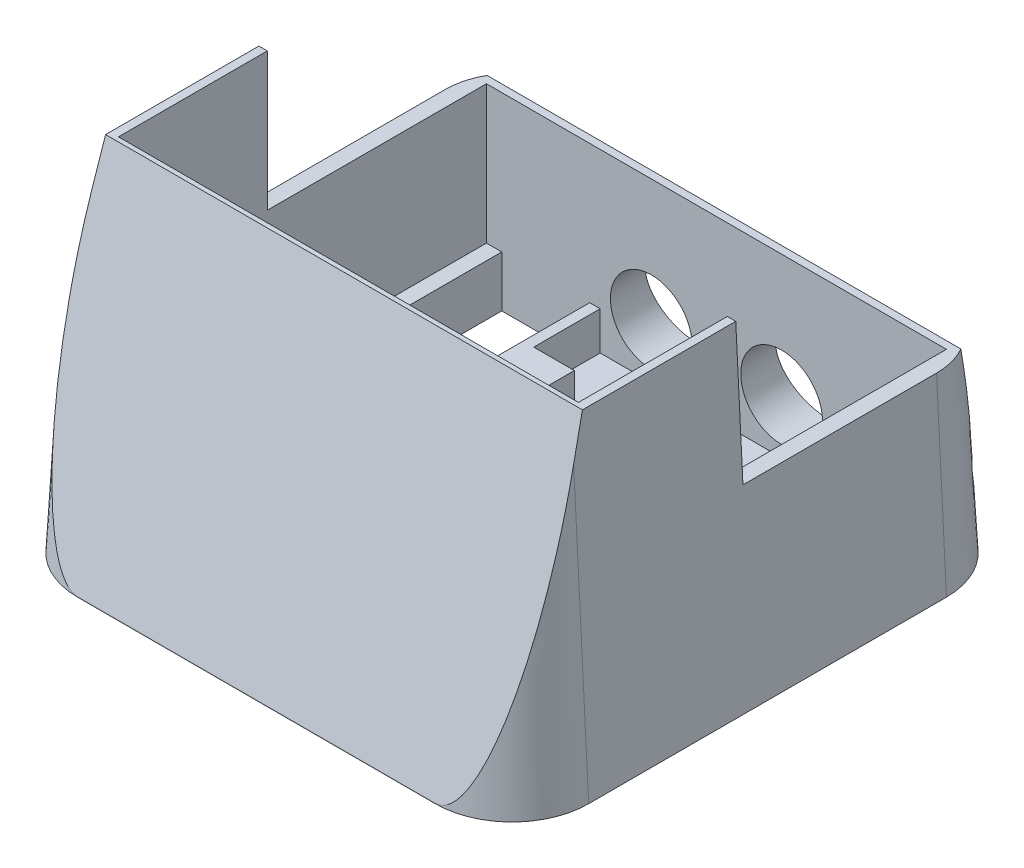
from build123d import *

# Parameters (mm, degrees)
BOSS_EXTRUDE1_DEPTH     = 10
SKETCH2_W               = 17.2
SKETCH2_H               = 43
CUT_EXTRUDE1_DEPTH      = 72.414284285
SKETCH3_W               = 90
SKETCH3_H               = 34
SKETCH3_W_2             = 80
SKETCH3_H_2             = 24
BOSS_EXTRUDE3_DEPTH     = 15
SKETCH4_W               = 49.6
SKETCH4_H               = 5
BOSS_EXTRUDE4_DEPTH     = 10
SKETCH5_W               = 15
SKETCH5_H               = 22
BOSS_EXTRUDE5_DEPTH     = 5
SKETCH6_W               = 90
SKETCH6_H               = 77
BOSS_EXTRUDE6_DEPTH     = 15
BOSS_EXTRUDE8_DEPTH     = 39
CHAMFER1_SIZE           = 64
CHAMFER1_SIZE_2         = 3.354097874
CHAMFER2_SIZE           = 64
CHAMFER2_SIZE_2         = 11.405813635
CHAMFER3_SIZE           = 64
CHAMFER3_SIZE_2         = 13.775745352
CUT_EXTRUDE3_DEPTH      = 95.500525601
CUT_EXTRUDE3_DEPTH_BACK = 95.500525601
SKETCH10_W              = 50
SKETCH10_H              = 27
SKETCH11_W              = 45.5
SKETCH11_H              = 10.5
CUT_EXTRUDE4_DEPTH      = 7.5
SKETCH14_W              = 2.05
SKETCH14_H              = 10.5
BOSS_EXTRUDE9_DEPTH     = 15
SKETCH15_R              = 8
CUT_EXTRUDE5_DEPTH      = 122.227059686
CUT_EXTRUDE6_DEPTH      = 2.5
CUT_EXTRUDE7_REACH      = 97.373
SKETCH18_W              = 29.6
SKETCH18_H              = 45
CUT_EXTRUDE8_DEPTH      = 15
SKETCH21_W              = 29.6
SKETCH21_H              = 35
BOSS_EXTRUDE10_DEPTH    = 2.5
SKETCH22_W              = 90
SKETCH22_H              = 72
CUT_EXTRUDE9_DEPTH      = 54


with BuildPart() as part:
    # Sketch1 → Boss-Extrude1 (new body)
    with BuildSketch(Plane(origin=(0, 0, 0), x_dir=(1, 0, 0), z_dir=(0, 1, 0))):
        with BuildLine():
            Line((-35, 50), (35, 50))
            ThreePointArc((35, 50), (45.606601718, 45.606601718), (50, 35))
            Line((50, 35), (50, -35))
            ThreePointArc((50, -35), (45.606601718, -45.606601718), (35, -50))
            Line((35, -50), (-35, -50))
            ThreePointArc((-35, -50), (-45.606601718, -45.606601718), (-50, -35))
            Line((-50, -35), (-50, 35))
            ThreePointArc((-50, 35), (-45.606601718, 45.606601718), (-35, 50))
        make_face()
    extrude(amount=BOSS_EXTRUDE1_DEPTH)

    # Sketch2 → Cut-Extrude1 (cut, through all)
    with BuildSketch(Plane(origin=(0, 10, 0), x_dir=(1, 0, 0), z_dir=(0, 1, 0))):
        with Locations((-33.4, 18.5)):
            Rectangle(SKETCH2_W, SKETCH2_H)
        with Locations((33.4, 18.5)):
            Rectangle(SKETCH2_W, SKETCH2_H)
    extrude(amount=-CUT_EXTRUDE1_DEPTH, mode=Mode.SUBTRACT)

    # Sketch3 → Boss-Extrude3 (add)
    with BuildSketch(Plane(origin=(0, 10, 0), x_dir=(1, 0, 0), z_dir=(0, 1, 0))):
        with Locations((0, -20)):
            Rectangle(SKETCH3_W, SKETCH3_H)
        with Locations((0, -20)):
            Rectangle(SKETCH3_W_2, SKETCH3_H_2, mode=Mode.SUBTRACT)
    extrude(amount=BOSS_EXTRUDE3_DEPTH)

    # Sketch4 → Boss-Extrude4 (add)
    with BuildSketch(Plane(origin=(0, 10, 0), x_dir=(1, 0, 0), z_dir=(0, 1, 0))):
        with Locations((0, 10)):
            Rectangle(SKETCH4_W, SKETCH4_H)
        with Locations((0, 27)):
            Rectangle(SKETCH4_W, SKETCH4_H)
    extrude(amount=BOSS_EXTRUDE4_DEPTH)

    # Sketch5 → Boss-Extrude5 (add)
    with BuildSketch(Plane(origin=(0, 20, 0), x_dir=(1, 0, 0), z_dir=(0, 1, 0))):
        with Locations((-17.3, 18.5)):
            Rectangle(SKETCH5_W, SKETCH5_H)
        with Locations((17.3, 18.5)):
            Rectangle(SKETCH5_W, SKETCH5_H)
    extrude(amount=BOSS_EXTRUDE5_DEPTH)

    # Sketch6 → Boss-Extrude6 (add)
    with BuildSketch(Plane(origin=(0, 10, 0), x_dir=(1, 0, 0), z_dir=(0, 1, 0))):
        with BuildLine():
            Line((-50, 35), (-50, -35))
            ThreePointArc((-50, -35), (-45.606601718, -45.606601718), (-35, -50))
            Line((-35, -50), (35, -50))
            ThreePointArc((35, -50), (45.606601718, -45.606601718), (50, -35))
            Line((50, -35), (50, 35))
            ThreePointArc((50, 35), (45.606601718, 45.606601718), (35, 50))
            Line((35, 50), (-35, 50))
            ThreePointArc((-35, 50), (-45.606601718, 45.606601718), (-50, 35))
        make_face()
        with Locations((0, 1.5)):
            Rectangle(SKETCH6_W, SKETCH6_H, mode=Mode.SUBTRACT)
    extrude(amount=BOSS_EXTRUDE6_DEPTH)

    # Sketch9 → Boss-Extrude8 (add)
    with BuildSketch(Plane(origin=(0, 25, 0), x_dir=(1, 0, 0), z_dir=(0, 1, 0))):
        with BuildLine():
            Line((-50, 35), (-50, -35))
            ThreePointArc((-50, -35), (-45.606601718, -45.606601718), (-35, -50))
            Line((-35, -50), (35, -50))
            ThreePointArc((35, -50), (45.606601718, -45.606601718), (50, -35))
            Line((50, -35), (50, 35))
            ThreePointArc((50, 35), (45.606601718, 45.606601718), (35, 50))
            Line((35, 50), (-35, 50))
            ThreePointArc((-35, 50), (-45.606601718, 45.606601718), (-50, 35))
        make_face()
        with BuildLine():
            Line((-45, 35), (-45, -32))
            Line((-45, -32), (45, -32))
            Line((45, -32), (45, 35))
            ThreePointArc((45, 35), (44.659258263, 37.588190451), (43.660254038, 40))
            Line((43.660254038, 40), (-43.660254038, 40))
            ThreePointArc((-43.660254038, 40), (-44.659258263, 37.588190451), (-45, 35))
        make_face(mode=Mode.SUBTRACT)
    extrude(amount=BOSS_EXTRUDE8_DEPTH)

    # Chamfer1
    # the kernel refuses this chamfer: 64, 3.354097874 mm, written as the material it takes off along each edge
    with BuildSketch(Plane(origin=(-35, 64, 50), x_dir=(0, -0.9999979738662979, 0.002013023422382214), z_dir=(1, 0, 0)), Plane(origin=(50, 64, 35), x_dir=(0.002013023422382214, -0.9999979738662979, 0), z_dir=(0, 0, -1)), Plane(origin=(-50, 64, -35), x_dir=(-0.002013023422382214, -0.9999979738662979, 0), z_dir=(0, 0, 1)), Plane(origin=(35, 64, -50), x_dir=(0, -0.9999979738662979, -0.002013023422382214), z_dir=(-1, 0, 0))) as chamfer1_piece_1:
        Polygon((CHAMFER1_SIZE * 0.999997973866, CHAMFER1_SIZE * 0.00201302342238), (-CHAMFER1_SIZE_2 * 0.00201302342245, CHAMFER1_SIZE_2 * 0.9999979739), (0, 0), align=None)
    extrude(amount=70, mode=Mode.SUBTRACT)
    with BuildSketch(Plane(origin=(35, 64, 35), x_dir=(0, 0, 1), z_dir=(-1, 0, 0))) as chamfer1_piece_2:
        Polygon((15, -CHAMFER1_SIZE), (15 - CHAMFER1_SIZE_2, 0), (15, 0), align=None)
    revolve(axis=Axis((35, 64, 35), (0, 1, 0)), revolution_arc=90, mode=Mode.SUBTRACT)
    with BuildSketch(Plane(origin=(-35, 64, 35), x_dir=(-1, 0, 0), z_dir=(0, 0, -1))) as chamfer1_piece_3:
        Polygon((15, -CHAMFER1_SIZE), (15 - CHAMFER1_SIZE_2, 0), (15, 0), align=None)
    revolve(axis=Axis((-35, 64, 35), (0, 1, 0)), revolution_arc=90, mode=Mode.SUBTRACT)
    with BuildSketch(Plane(origin=(35, 64, -35), x_dir=(1, 0, 0), z_dir=(0, 0, 1))) as chamfer1_piece_4:
        Polygon((15, -CHAMFER1_SIZE), (15 - CHAMFER1_SIZE_2, 0), (15, 0), align=None)
    revolve(axis=Axis((35, 64, -35), (0, 1, 0)), revolution_arc=90, mode=Mode.SUBTRACT)
    with BuildSketch(Plane(origin=(-35, 64, -35), x_dir=(0, 0, -1), z_dir=(1, 0, 0))) as chamfer1_piece_5:
        Polygon((15 - CHAMFER1_SIZE_2, 0), (15, -CHAMFER1_SIZE), (15, 0), align=None)
    revolve(axis=Axis((-35, 64, -35), (0, 1, 0)), revolution_arc=90, mode=Mode.SUBTRACT)

    # Chamfer2
    # the kernel refuses this chamfer: 64, 11.405813635 mm, written as the material it takes off along each edge
    with BuildSketch(Plane(origin=(201.306482971, 64, -46.645902126), x_dir=(0, -0.9982575003065525, -0.05900816114499234), z_dir=(-1, 0, 0))) as chamfer2_piece_1:
        Polygon((CHAMFER2_SIZE * 0.999977671636, CHAMFER2_SIZE * 0.0066825316561), (-CHAMFER2_SIZE_2 * 0.0590081611462, CHAMFER2_SIZE_2 * 0.998257500326), (0, 0), align=None)
    extrude(amount=402.612965942, mode=Mode.SUBTRACT)

    # Chamfer3
    # the kernel refuses this chamfer: 64, 13.775745352 mm, written as the material it takes off along each edge
    with BuildSketch(Plane(origin=(-201.265469314, 64, 46.645902126), x_dir=(0, -0.9981787050157903, 0.06032638604292662), z_dir=(1, 0, 0))) as chamfer3_piece_1:
        Polygon((CHAMFER3_SIZE * 0.999967974892, CHAMFER3_SIZE * 0.00800307379952), (-CHAMFER3_SIZE_2 * 0.060326386045, CHAMFER3_SIZE_2 * 0.99817870505), (0, 0), align=None)
    extrude(amount=402.530938629, mode=Mode.SUBTRACT)

    # Sketch10 → Cut-Extrude3 (cut, two sides: drawn at the far end of the back side and taken through both)
    with BuildSketch(Plane(origin=(0, 1.307501734, 0), x_dir=(0, 0, 1), z_dir=(-1, 0, 0)).offset(-CUT_EXTRUDE3_DEPTH_BACK)):
        with Locations((-22.129843227, 49.192498266)):
            Rectangle(SKETCH10_W, SKETCH10_H)
    extrude(amount=CUT_EXTRUDE3_DEPTH + CUT_EXTRUDE3_DEPTH_BACK, mode=Mode.SUBTRACT)

    # Sketch11 → Cut-Extrude4 (cut)
    with BuildSketch(Plane(origin=(0, 10, 0), x_dir=(1, 0, 0), z_dir=(0, 1, 0))):
        with Locations((0, 34.75)):
            Rectangle(SKETCH11_W, SKETCH11_H)
    extrude(amount=-CUT_EXTRUDE4_DEPTH, mode=Mode.SUBTRACT)

    # Sketch14 → Boss-Extrude9 (add)
    with BuildSketch(Plane(origin=(0, 10, 0), x_dir=(1, 0, 0), z_dir=(0, 1, 0))):
        with Locations((-23.775, 34.75)):
            Rectangle(SKETCH14_W, SKETCH14_H)
        with Locations((23.775, 34.75)):
            Rectangle(SKETCH14_W, SKETCH14_H)
    extrude(amount=BOSS_EXTRUDE9_DEPTH)

    # Sketch15 → Cut-Extrude5 (cut, through all)
    with BuildSketch(Plane.XY.offset(-40)):
        with Locations((-12.75, 12.75)):
            Circle(SKETCH15_R)
        with Locations((12.75, 12.75)):
            Circle(SKETCH15_R)
    extrude(amount=-CUT_EXTRUDE5_DEPTH, mode=Mode.SUBTRACT)

    # Sketch17 → Cut-Extrude6 (cut)
    with BuildSketch(Plane(origin=(0, 0, -29.5), x_dir=(-1, 0, 0), z_dir=(0, 0, -1))):
        Polygon((-9.8, 25), (-22.75, 25), (-22.75, 2.5), (22.75, 2.5), (22.75, 25), (9.8, 25), (9.8, 20), (-9.8, 20), align=None)
    extrude(amount=-CUT_EXTRUDE6_DEPTH, mode=Mode.SUBTRACT)

    # Cut-Extrude7: up to this face of the body (flat: up to its plane)
    cut_extrude7_end = Plane(part.part.faces().sort_by_distance((0, 10, -18.5))[0])
    # Sketch18 → Cut-Extrude7 (cut, up to the picked face)
    with BuildSketch(Plane.XZ, mode=Mode.PRIVATE) as cut_extrude7_sk1:
        with Locations((0, -4.5)):
            Rectangle(SKETCH18_W, SKETCH18_H)
    cut_extrude7_tool1 = split(extrude(cut_extrude7_sk1.sketch, amount=-CUT_EXTRUDE7_REACH, mode=Mode.PRIVATE), bisect_by=cut_extrude7_end, keep=Keep.BOTH, mode=Mode.PRIVATE)
    add(cut_extrude7_tool1.solids().sort_by(Axis((0, 0, -4.5), (0, 1, 0)))[0], mode=Mode.SUBTRACT)

    # Sketch20 → Cut-Extrude8 (cut)
    with BuildSketch(Plane.XZ.offset(-25)):
        with BuildLine():
            Line((-45, -35), (-45, -40))
            Line((-45, -40), (-43.660254038, -40))
            ThreePointArc((-43.660254038, -40), (-44.659258263, -37.588190451), (-45, -35))
        make_face()
        with BuildLine():
            Line((45, -40), (45, -35))
            ThreePointArc((45, -35), (44.659258263, -37.588190451), (43.660254038, -40))
            Line((43.660254038, -40), (45, -40))
        make_face()
    extrude(amount=-CUT_EXTRUDE8_DEPTH, mode=Mode.SUBTRACT)

    # Sketch21 → Boss-Extrude10 (add)
    with BuildSketch(Plane.XZ):
        with Locations((0, 0.5)):
            Rectangle(SKETCH21_W, SKETCH21_H)
    extrude(amount=-BOSS_EXTRUDE10_DEPTH)

    # Sketch22 → Cut-Extrude9 (cut)
    with BuildSketch(Plane(origin=(0, 64, 0), x_dir=(1, 0, 0), z_dir=(0, 1, 0))):
        with Locations((0, 4)):
            Rectangle(SKETCH22_W, SKETCH22_H)
    extrude(amount=-CUT_EXTRUDE9_DEPTH, mode=Mode.SUBTRACT)


solid = part.part
